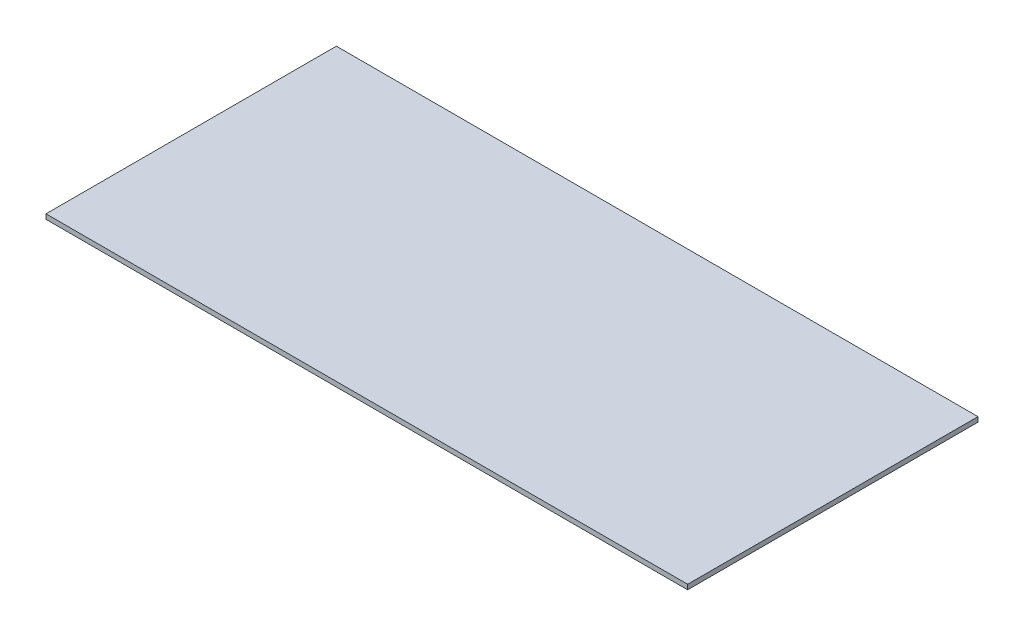
from build123d import *

# Parameters (mm, degrees)
SKETCH1_W           = 400
SKETCH1_H           = 181
BOSS_EXTRUDE1_DEPTH = 3


with BuildPart() as part:
    # Sketch1 → Boss-Extrude1 (new body)
    with BuildSketch(Plane(origin=(0, 0, 0), x_dir=(1, 0, 0), z_dir=(0, 1, 0))):
        with Locations((200, 90.5)):
            Rectangle(SKETCH1_W, SKETCH1_H)
    extrude(amount=BOSS_EXTRUDE1_DEPTH)


solid = part.part
